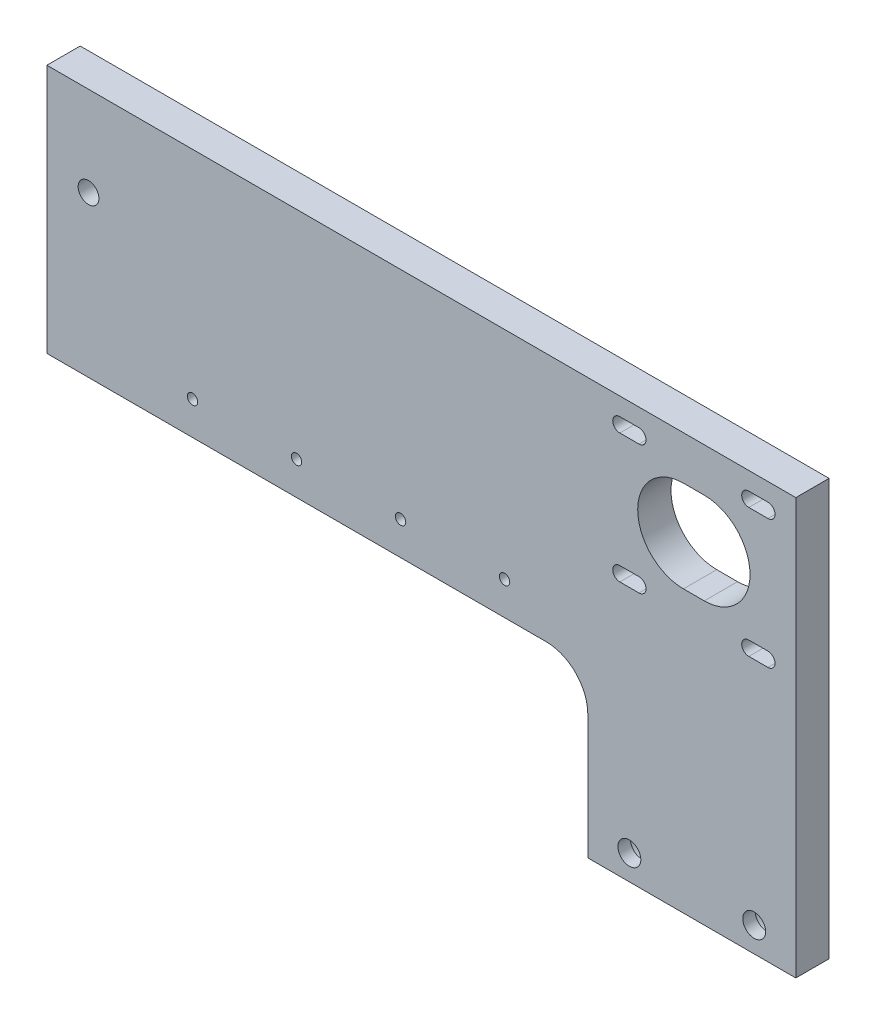
from build123d import *

# Parameters (mm, degrees)
BODY_DEPTH                     = 8
M3_CLEARANCE_SLOT1_DEPTH       = 8
LPATTERN3_COUNT                = 2
LPATTERN3_PITCH                = 31
LPATTERN3_COUNT_DIR2           = 2
LPATTERN3_PITCH_DIR2           = 31
CUT_EXTRUDE1_DEPTH             = 207.067949958
M3X0_5_TAPPED_HOLE1_D          = 2.5
LPATTERN2_COUNT                = 4
LPATTERN2_PITCH                = 25
CBORE_FOR_M5_SHCS1_D           = 5.5
CBORE_FOR_M5_SHCS1_CBORE_D     = 10
CBORE_FOR_M5_SHCS1_CBORE_DEPTH = 5
M3X0_5_TAPPED_HOLE2_D          = 2.5
M3X0_5_TAPPED_HOLE2_DEPTH      = 6.748924226
M3X0_5_TAPPED_HOLE2_TIP        = 0.751075774
SKETCH22_R                     = 2.5
CUT_EXTRUDE2_DEPTH             = 207.067949958


# Read off the part's stored shape, not the designer's step: M3 Clearance Slot1
with BuildPart() as part:
    # Sketch1 → BODY (new body)
    with BuildSketch(Plane.XY):
        with BuildLine():
            Line((-180, 100), (0, 100))
            Line((0, 100), (0, 0))
            Line((0, 0), (-50, 0))
            Line((-50, 0), (-50, 30))
            ThreePointArc((-50, 30), (-52.928932188, 37.071067812), (-60, 40))
            Line((-60, 40), (-180, 40))
            Line((-180, 40), (-180, 100))
        make_face()
    extrude(amount=BODY_DEPTH)

    # M3 Clearance Slot1 outline → M3 Clearance Slot1 (cut)
    with BuildSketch(Plane.XY):
        with BuildLine():
            Line((-42.3, 92.3), (-37.7, 92.3))
            ThreePointArc((-37.7, 92.3), (-36, 94), (-37.7, 95.7))
            Line((-37.7, 95.7), (-42.3, 95.7))
            ThreePointArc((-42.3, 95.7), (-44, 94), (-42.3, 92.3))
        make_face()
    m3_clearance_slot1 = extrude(amount=M3_CLEARANCE_SLOT1_DEPTH, mode=Mode.SUBTRACT)

    # LPattern3: M3 Clearance Slot1 2 × 2
    with Locations(*[(i * LPATTERN3_PITCH, -j * LPATTERN3_PITCH_DIR2, 0) for i in range(LPATTERN3_COUNT) for j in range(LPATTERN3_COUNT_DIR2) if (i, j) != (0, 0)]):
        add(m3_clearance_slot1, mode=Mode.SUBTRACT)

    # Sketch21 → Cut-Extrude1 (cut, through all)
    with BuildSketch(Plane.XY.offset(8)):
        with BuildLine():
            Line((-27, 89.5), (-22, 89.5))
            ThreePointArc((-22, 89.5), (-11, 78.5), (-22, 67.5))
            Line((-22, 67.5), (-27, 67.5))
            ThreePointArc((-27, 67.5), (-38, 78.5), (-27, 89.5))
        make_face()
    extrude(amount=-CUT_EXTRUDE1_DEPTH, mode=Mode.SUBTRACT)

    # M3x0.5 Tapped Hole1 (through all)
    with Locations(Plane.XY.offset(8)):
        with Locations((-70, 48)):
            m3x0_5_tapped_hole1 = Hole(M3X0_5_TAPPED_HOLE1_D / 2)

    # LPattern2: M3x0.5 Tapped Hole1 ×4
    with Locations(*[(-i * LPATTERN2_PITCH, 0, 0) for i in range(1, LPATTERN2_COUNT)]):
        add(m3x0_5_tapped_hole1, mode=Mode.SUBTRACT)

    # CBORE for M5 SHCS1 (through all)
    with Locations(Plane(origin=(0, 0, 0), x_dir=(-1, 0, 0), z_dir=(0, 0, -1))):
        with Locations((10, 6), (40, 6)):
            CounterBoreHole(CBORE_FOR_M5_SHCS1_D / 2, CBORE_FOR_M5_SHCS1_CBORE_D / 2, CBORE_FOR_M5_SHCS1_CBORE_DEPTH)

    # M3x0.5 Tapped Hole2
    with Locations(Plane.ZY.offset(180)):
        with Locations((4, 82), (4, 76)):
            Hole(M3X0_5_TAPPED_HOLE2_D / 2, depth=M3X0_5_TAPPED_HOLE2_DEPTH)
            with Locations((0, 0, -(M3X0_5_TAPPED_HOLE2_DEPTH + M3X0_5_TAPPED_HOLE2_TIP / 2))):  # 118° drill point
                Cone(0, M3X0_5_TAPPED_HOLE2_D / 2, M3X0_5_TAPPED_HOLE2_TIP, mode=Mode.SUBTRACT)

    # Sketch22 → Cut-Extrude2 (cut, through all)
    with BuildSketch(Plane.XY.offset(8)):
        with Locations((-170, 78.5)):
            Circle(SKETCH22_R)
    extrude(amount=-CUT_EXTRUDE2_DEPTH, mode=Mode.SUBTRACT)


solid = part.part
